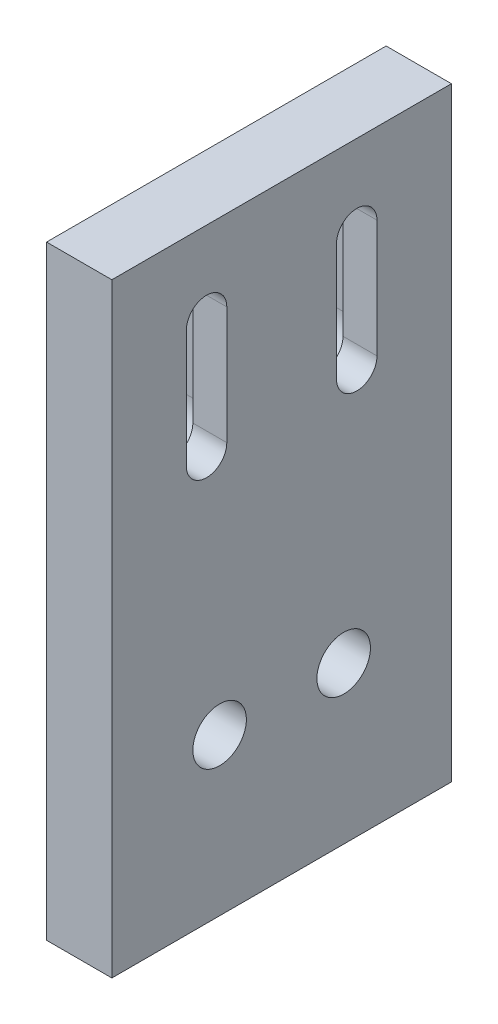
from build123d import *

# Parameters (mm, degrees)
PROFILESKETCH1_W                          = 5
PROFILESKETCH1_H                          = 46.3
BOSS_EXTRUDE1_DEPTH                       = 26
PROBESLIDINGMOUNTSKETCH4_R                = 2.05
PROBESLIDINGMOUNTCUT_EXTRUDE3_DEPTH       = 54.335635367
PROBESLIDINGMOUNTCHANELCUT_EXTRUDE4_DEPTH = 2.4


with BuildPart() as part:
    # ProfileSketch1 → Boss-Extrude1 (new body)
    with BuildSketch(Plane.XY):
        with Locations((2.5, 23.15)):
            Rectangle(PROFILESKETCH1_W, PROFILESKETCH1_H)
    extrude(amount=BOSS_EXTRUDE1_DEPTH)

    # ProbeSlidingMountSketch4 → ProbeSlidingMountCut-Extrude3 (cut, through all)
    with BuildSketch(Plane.ZY):
        with Locations((8.25, 12)):
            Circle(PROBESLIDINGMOUNTSKETCH4_R)
        with Locations((17.75, 12)):
            Circle(PROBESLIDINGMOUNTSKETCH4_R)
        with BuildLine():
            Line((5.7, 40.1), (5.7, 31.1))
            ThreePointArc((5.7, 31.1), (7.25, 29.55), (8.8, 31.1))
            Line((8.8, 31.1), (8.8, 40.1))
            ThreePointArc((8.8, 40.1), (7.25, 41.65), (5.7, 40.1))
        make_face()
        with BuildLine():
            Line((17.2, 40.1), (17.2, 31.1))
            ThreePointArc((17.2, 31.1), (18.75, 29.55), (20.3, 31.1))
            Line((20.3, 31.1), (20.3, 40.1))
            ThreePointArc((20.3, 40.1), (18.75, 41.65), (17.2, 40.1))
        make_face()
    extrude(amount=-PROBESLIDINGMOUNTCUT_EXTRUDE3_DEPTH, mode=Mode.SUBTRACT)

    # ProbeSlidingMountChannelSketch5 → ProbeSlidingMountChanelCut-Extrude4 (cut)
    with BuildSketch(Plane.ZY):
        with BuildLine():
            Line((10.45, 40.1), (10.45, 31.1))
            ThreePointArc((10.45, 31.1), (7.25, 27.9), (4.05, 31.1))
            Line((4.05, 31.1), (4.05, 40.1))
            ThreePointArc((4.05, 40.1), (7.25, 43.3), (10.45, 40.1))
        make_face()
        with BuildLine():
            Line((21.95, 40.1), (21.95, 31.1))
            ThreePointArc((21.95, 31.1), (18.75, 27.9), (15.55, 31.1))
            Line((15.55, 31.1), (15.55, 40.1))
            ThreePointArc((15.55, 40.1), (18.75, 43.3), (21.95, 40.1))
        make_face()
    extrude(amount=-PROBESLIDINGMOUNTCHANELCUT_EXTRUDE4_DEPTH, mode=Mode.SUBTRACT)


solid = part.part
